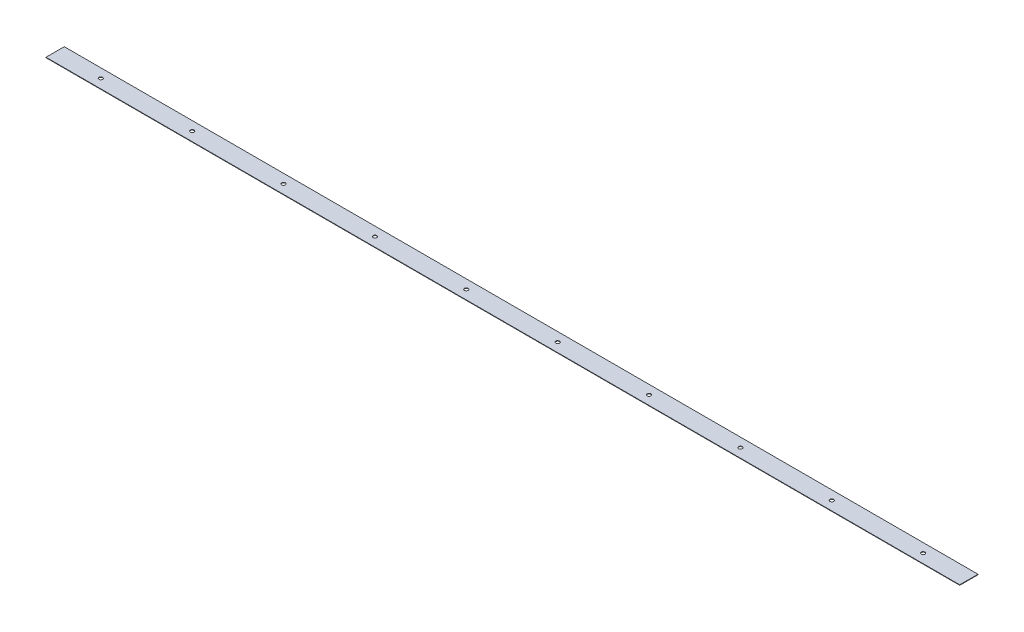
from build123d import *

# Parameters (mm, degrees)
SKETCH1_W          = 1000
SKETCH1_H          = 20
BASE_FLANGE1_DEPTH = 0.5
SKETCH2_R          = 2
CUT_EXTRUDE1_DEPTH = 10


# Sheet-metal steps are written as plain solids
with BuildPart() as part:
    # Sketch1 → Base-Flange1 (new body)
    with BuildSketch(Plane(origin=(0, 0, 0), x_dir=(1, 0, 0), z_dir=(0, 1, 0))):
        Rectangle(SKETCH1_W, SKETCH1_H)
    extrude(amount=-BASE_FLANGE1_DEPTH)

    # Sketch2 → Cut-Extrude1 (cut)
    with BuildSketch(Plane(origin=(0, 0, 0), x_dir=(1, 0, 0), z_dir=(0, 1, 0))):
        with Locations(Location((-450, 0, 0), (0, 0, 270))):
            Circle(SKETCH2_R)
        with Locations(Location((-350, 0, 0), (0, 0, 270))):
            Circle(SKETCH2_R)
        with Locations(Location((-250, 0, 0), (0, 0, 270))):
            Circle(SKETCH2_R)
        with Locations(Location((-150, 0, 0), (0, 0, 270))):
            Circle(SKETCH2_R)
        with Locations(Location((-50, 0, 0), (0, 0, 270))):
            Circle(SKETCH2_R)
        with Locations(Location((50, 0, 0), (0, 0, 270))):
            Circle(SKETCH2_R)
        with Locations(Location((150, 0, 0), (0, 0, 270))):
            Circle(SKETCH2_R)
        with Locations(Location((250, 0, 0), (0, 0, 270))):
            Circle(SKETCH2_R)
        with Locations(Location((350, 0, 0), (0, 0, 270))):
            Circle(SKETCH2_R)
        with Locations(Location((450, 0, 0), (0, 0, 270))):
            Circle(SKETCH2_R)
    extrude(amount=-CUT_EXTRUDE1_DEPTH, mode=Mode.SUBTRACT)


solid = part.part
